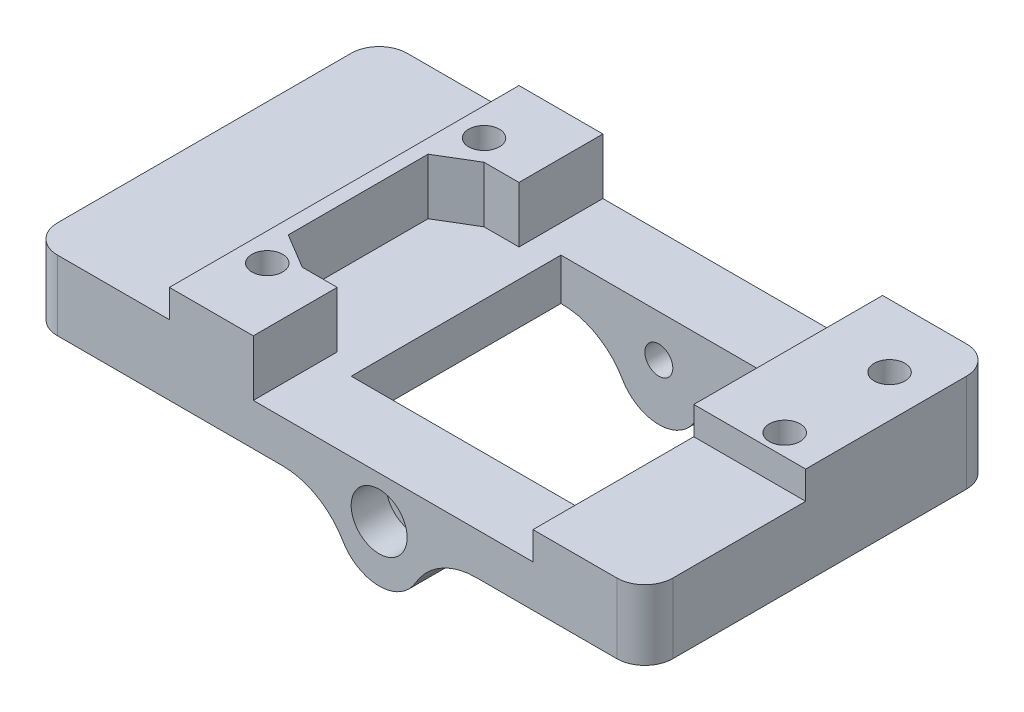
from build123d import *
from build123d.topology import SkipClean

# Parameters (mm, degrees)
SKETCH_1_W           = 50
SKETCH_1_H           = 25
EXTRUDE_1_DEPTH      = 7
EXTRUDE_2_DEPTH      = 5
SKETCH_3_R           = 1
CUT_EXTRUDE_1_DEPTH  = 37.041642582
SKETCH_5_W           = 6
SKETCH_5_H           = 25
CUT_EXTRUDE_5_DEPTH  = 31.037476592
SKETCH_6_R           = 2
CUT_EXTRUDE_6_DEPTH  = 2.5
FILLET_2_R           = 2
FILLET_3_R           = 5
SKETCH_8_R           = 1.1
CUT_EXTRUDE_9_DEPTH  = 31.037476592
CUT_EXTRUDE_4_DEPTH  = 4
SKETCH_7_W           = 16
SKETCH_7_H           = 15
CUT_EXTRUDE_7_DEPTH  = 29.814059068
SKETCH_10_R          = 3
CUT_EXTRUDE_11_DEPTH = 3
SKETCH_12_R          = 2
EXTRUDE_3_DEPTH      = 5
SKETCH_13_W          = 10
SKETCH_13_H          = 25
SKETCH_13_W_2        = 8
SKETCH_13_H_2        = 11.5
CUT_EXTRUDE_12_DEPTH = 2


with BuildPart() as part:
    # 草图1 → 凸台-拉伸1 (new body)
    with BuildSketch(Plane(origin=(0, 0, 0), x_dir=(1, 0, 0), z_dir=(0, 1, 0))):
        Rectangle(SKETCH_1_W, SKETCH_1_H)
    extrude(amount=EXTRUDE_1_DEPTH)

    # 草图2 → 凸台-拉伸2 (add)
    with BuildSketch(Plane.XY.offset(12.5)):
        with BuildLine():
            Line((-2.828427125, 0), (2.828427125, 0))
            ThreePointArc((2.828427125, 0), (0, -4), (-2.828427125, 0))
        make_face()
    extrude_2 = extrude(amount=-EXTRUDE_2_DEPTH)

    # 草图3 → 切除-拉伸1 (cut, through all)
    with BuildSketch(Plane.XY.offset(12.5)):
        Circle(SKETCH_3_R)
    cut_extrude_1 = extrude(amount=-CUT_EXTRUDE_1_DEPTH, mode=Mode.SUBTRACT)

    # 镜向1: 凸台-拉伸2, 切除-拉伸1 across plane
    with SkipClean():  # the faces are left unmerged after this step: merging them gives an invalid solid
        add(extrude_2.mirror(Plane.XY))
        add(cut_extrude_1.mirror(Plane.XY), mode=Mode.SUBTRACT)

    # 草图5 → 切除-拉伸5 (cut, through all)
    with SkipClean():  # the faces are left unmerged after this step: merging them gives an invalid solid
        with BuildSketch(Plane(origin=(0, 7, 0), x_dir=(1, 0, 0), z_dir=(0, 1, 0))):
            with Locations((22, 0)):
                Rectangle(SKETCH_5_W, SKETCH_5_H)
        extrude(amount=-CUT_EXTRUDE_5_DEPTH, mode=Mode.SUBTRACT)

    # 草图6 → 切除-拉伸6 (cut)
    with SkipClean():  # the faces are left unmerged after this step: merging them gives an invalid solid
        with BuildSketch(Plane.XY.offset(12.5)):
            Circle(SKETCH_6_R)
        extrude(amount=-CUT_EXTRUDE_6_DEPTH, mode=Mode.SUBTRACT)

    # 圆角2
    fillet_2_edges = [part.edges().sort_by_distance(p)[0] for p in [
        (-25, 3.5, -12.5),
        (-25, 3.5, 12.5),
        (19, 3.5, 12.5),
        (19, 3.5, -12.5),
    ]]
    fillet(fillet_2_edges, radius=FILLET_2_R)

    # 圆角3
    fillet_3_edges = [part.edges().sort_by_distance(p)[0] for p in [
        (-2.828427125, 0, 10),
        (2.828427125, 0, 10),
        (2.828427125, 0, -10),
        (-2.828427125, 0, -10),
    ]]
    fillet(fillet_3_edges, radius=FILLET_3_R)

    # 草图8 → 切除-拉伸9 (cut, through all)
    with SkipClean():  # the faces are left unmerged after this step: merging them gives an invalid solid
        with BuildSketch(Plane(origin=(0, 7, 0), x_dir=(1, 0, 0), z_dir=(0, 1, 0))):
            with Locations((-13, 8)):
                Circle(SKETCH_8_R)
            with Locations((-13, -7.5)):
                Circle(SKETCH_8_R)
            with Locations((16, 8)):
                Circle(SKETCH_8_R)
            with Locations((16, 0.5)):
                Circle(SKETCH_8_R)
        extrude(amount=-CUT_EXTRUDE_9_DEPTH, mode=Mode.SUBTRACT)

    # 草图4 → 切除-拉伸4 (cut)
    with SkipClean():  # the faces are left unmerged after this step: merging them gives an invalid solid
        with BuildSketch(Plane(origin=(0, 7, 0), x_dir=(1, 0, 0), z_dir=(0, 1, 0))):
            Polygon((-9, -12.5), (11, -12.5), (11, 12.5), (-9, 12.5), (-9, 6.5), (-11.5, 6.5), (-14, 5), (-14, -5), (-11.5, -6.5), (-9, -6.5), align=None)
        extrude(amount=-CUT_EXTRUDE_4_DEPTH, mode=Mode.SUBTRACT)

    # 草图7 → 切除-拉伸7 (cut, through all)
    with SkipClean():  # the faces are left unmerged after this step: merging them gives an invalid solid
        with BuildSketch(Plane(origin=(0, 3, 0), x_dir=(1, 0, 0), z_dir=(0, 1, 0))):
            with Locations((1, 0)):
                Rectangle(SKETCH_7_W, SKETCH_7_H)
        extrude(amount=-CUT_EXTRUDE_7_DEPTH, mode=Mode.SUBTRACT)

    # 草图10 → 切除-拉伸11 (cut)
    with SkipClean():  # the faces are left unmerged after this step: merging them gives an invalid solid
        with BuildSketch(Plane.XZ):
            with Locations((-20, 0)):
                Circle(SKETCH_10_R)
        extrude(amount=-CUT_EXTRUDE_11_DEPTH, mode=Mode.SUBTRACT)

    # 草图12 → 凸台-拉伸3 (add)
    with SkipClean():  # the faces are left unmerged after this step: merging them gives an invalid solid
        with BuildSketch(Plane.XZ.offset(-3)):
            with Locations((-20, 0)):
                Circle(SKETCH_12_R)
        extrude(amount=EXTRUDE_3_DEPTH)

    # 草图13 → 切除-拉伸12 (cut)
    with SkipClean():  # the faces are left unmerged after this step: merging them gives an invalid solid
        with BuildSketch(Plane(origin=(0, 7, 0), x_dir=(1, 0, 0), z_dir=(0, 1, 0))):
            with Locations((-20, 0)):
                Rectangle(SKETCH_13_W, SKETCH_13_H)
            with Locations((15, -6.75)):
                Rectangle(SKETCH_13_W_2, SKETCH_13_H_2)
        extrude(amount=-CUT_EXTRUDE_12_DEPTH, mode=Mode.SUBTRACT)


solid = part.part
